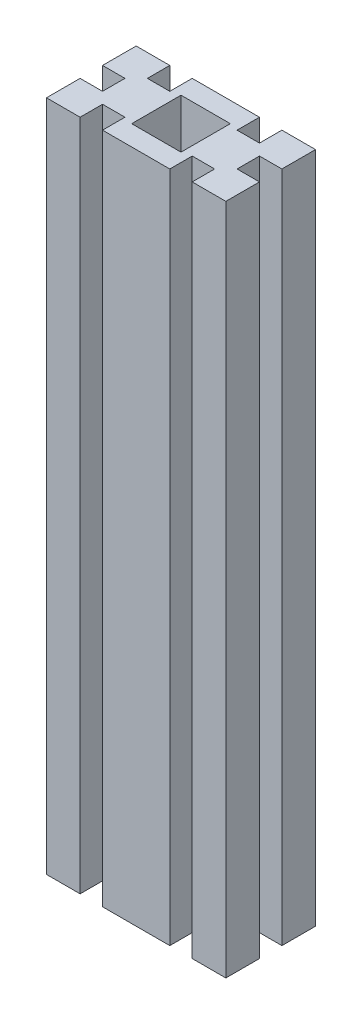
from build123d import *

# Parameters (mm, degrees)
SKETCH1_W       = 40
SKETCH1_H       = 20
BODY_DEPTH      = 150
SKETCH2_W       = 5
SKETCH2_H       = 5
SKETCH2_W_2     = 11
SKETCH2_H_2     = 11
PROFILAGE_DEPTH = 152.657508881


with BuildPart() as part:
    # Sketch1 → Body (new body)
    with BuildSketch(Plane(origin=(0, 0, 0), x_dir=(1, 0, 0), z_dir=(0, 1, 0))):
        Rectangle(SKETCH1_W, SKETCH1_H)
    extrude(amount=BODY_DEPTH)

    # Sketch2 → Profilage (cut, through all)
    with BuildSketch(Plane(origin=(0, 150, 0), x_dir=(1, 0, 0), z_dir=(0, 1, 0))):
        with Locations((-10, 7.5)):
            Rectangle(SKETCH2_W, SKETCH2_H)
        with Locations((-17.5, 0)):
            Rectangle(SKETCH2_W, SKETCH2_H)
        with Locations((-10, -7.5)):
            Rectangle(SKETCH2_W, SKETCH2_H)
        with Locations((10, -7.5)):
            Rectangle(SKETCH2_W, SKETCH2_H)
        with Locations((17.5, 0)):
            Rectangle(SKETCH2_W, SKETCH2_H)
        with Locations((10, 7.5)):
            Rectangle(SKETCH2_W, SKETCH2_H)
        Rectangle(SKETCH2_W_2, SKETCH2_H_2)
    extrude(amount=-PROFILAGE_DEPTH, mode=Mode.SUBTRACT)


solid = part.part
